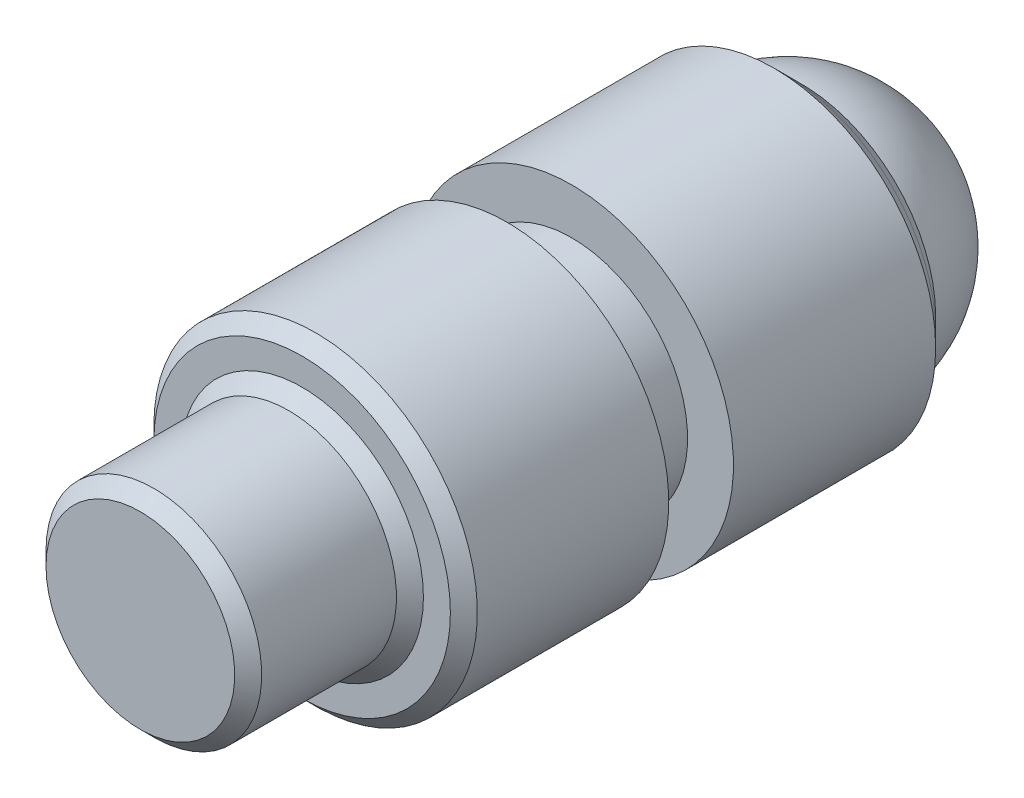
from build123d import *


with BuildPart() as part:
    # Sketch_plunger → Rev_plunger (revolve)
    with BuildSketch(Plane(origin=(0, 0, 0), x_dir=(1, 0, 0), z_dir=(0, 1, 0)), mode=Mode.PRIVATE) as rev_plunger_sk:
        with BuildLine():
            Line((0, 5), (0, -24))
            Line((0, -24), (4, -24))
            Line((4, -24), (4, -18))
            Line((4, -18), (6, -18))
            Line((6, -18), (6, -10.4))
            Line((6, -10.4), (4.3, -10.4))
            Line((4.3, -10.4), (4.3, -8))
            Line((4.3, -8), (6, -8))
            Line((6, -8), (6, 0))
            Line((6, 0), (5, 0))
            ThreePointArc((5, 0), (3.5355, 3.5355), (0, 5))
        make_face()
    revolve(rev_plunger_sk.sketch.rotate(Axis((0, 0, 0), (0, 0, 1)), 180), axis=Axis((0, 0, 0), (0, 0, 1)))

    # Chamfer_C05: read off the stored shape, not the designer's step
    # Chamfer_C05 outline → Chamfer_C05 (revolve, cut)
    with BuildSketch(Plane.XZ):
        Polygon((3.5, 24), (4, 23.5), (4, 24), align=None)
        Polygon((6, 18), (5.5, 18), (6, 17.5), align=None)
        Polygon((6, -0.52796442), (6, 0.5), (5.5, 0), (5.5, -0.52796442), align=None)
    revolve(axis=Axis((0, 0, 0), (0, 0, 1)), mode=Mode.SUBTRACT)

    # Chamfer_C05 2 outline → Chamfer_C05 2 (revolve)
    with BuildSketch(Plane.XZ):
        Polygon((4.5, 18), (4, 18.5), (4, 18), align=None)
        Polygon((5.5, 0.5), (4.97203558, 0.5), (4.97203558, -0.52796442), (5.5, 0), align=None)
    revolve(axis=Axis((0, 0, 0), (0, 0, 1)))

    # Chamfer_C05 3 outline → Chamfer_C05 3 (revolve)
    with BuildSketch(Plane.XZ):
        Polygon((5.5, 0.5), (5.5, 0), (6, 0.5), align=None)
    revolve(axis=Axis((0, 0, 0), (0, 0, 1)))


solid = part.part
